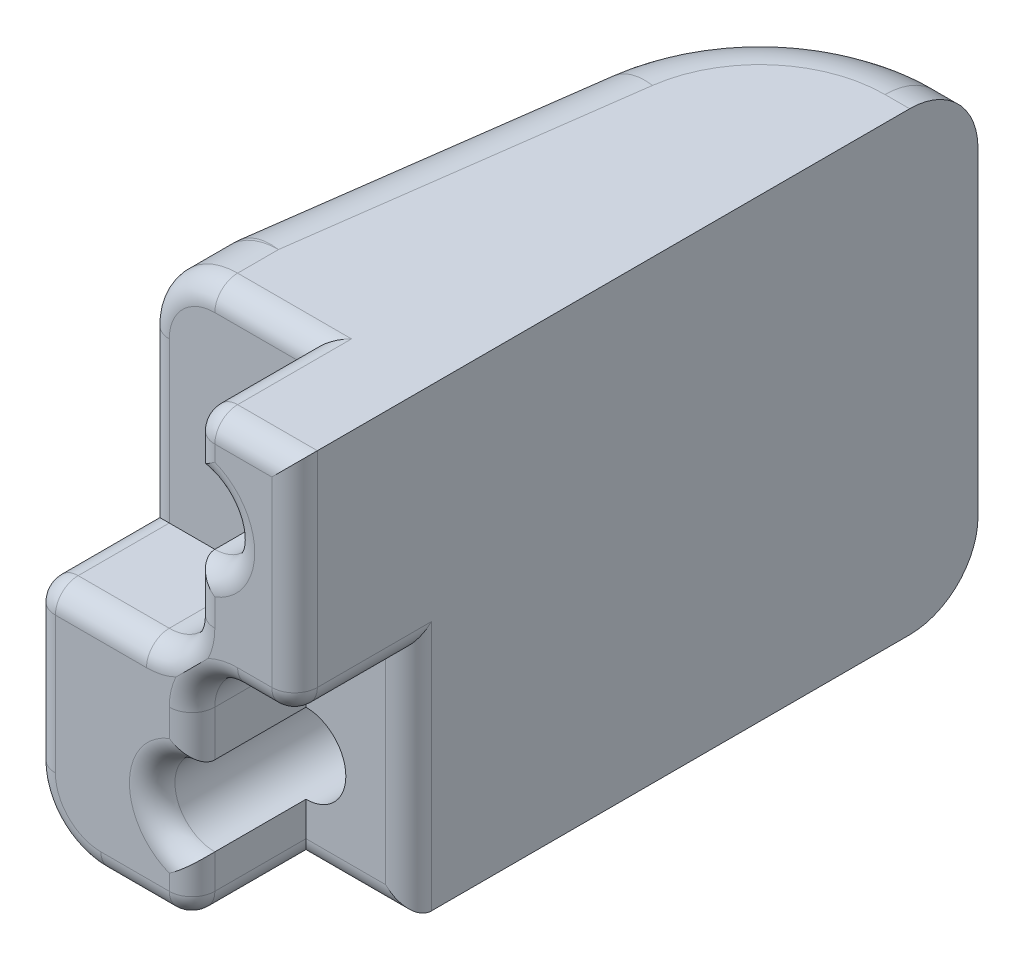
from build123d import *

# Parameters (mm, degrees)
BOSS_EXTRUDE1_DEPTH     = 10
CUT_EXTRUDE1_DEPTH      = 5
CUT_EXTRUDE2_DEPTH      = 35.583232932
CUT_EXTRUDE2_DEPTH_BACK = 35.583232932
SKETCH3_R               = 1.75
CUT_EXTRUDE3_START      = -12
SKETCH4_R               = 3.25
CUT_EXTRUDE3_DEPTH      = 23.583232932
FILLET1_R               = 8.5
FILLET2_R               = 1
FILLET3_R               = 3


with BuildPart() as part:
    # Sketch1 → Boss-Extrude1 (new, symmetric)
    with BuildSketch(Plane(origin=(0, 0, 0), x_dir=(1, 0, 0), z_dir=(0, 1, 0))):
        Polygon((14, 0), (14, 8), (11, 30), (2.5, 30), (2.5, 8), (2.5, 0), align=None)
    extrude(amount=BOSS_EXTRUDE1_DEPTH, both=True)

    # Sketch2 → Cut-Extrude1 (cut)
    with BuildSketch(Plane.XY):
        with BuildLine():
            Line((14, 10), (7, 10))
            Line((7, 10), (7, 2))
            ThreePointArc((7, 2), (7.585786438, 0.585786438), (9, 0))
            Line((9, 0), (14, 0))
            Line((14, 0), (14, 10))
        make_face()
        with BuildLine():
            Line((5, 0), (2.5, 0))
            Line((2.5, 0), (2.5, -10))
            Line((2.5, -10), (7, -10))
            Line((7, -10), (7, -2))
            ThreePointArc((7, -2), (6.414213562, -0.585786438), (5, 0))
        make_face()
    extrude(amount=-CUT_EXTRUDE1_DEPTH, mode=Mode.SUBTRACT)

    # Sketch3 → Cut-Extrude2 (cut, two sides: drawn at the far end of the back side and taken through both)
    with BuildSketch(Plane.XY.offset(-CUT_EXTRUDE2_DEPTH_BACK)):
        with Locations((7, 5.75)):
            Circle(SKETCH3_R)
        with Locations((7, -5.75)):
            Circle(SKETCH3_R)
    extrude(amount=CUT_EXTRUDE2_DEPTH + CUT_EXTRUDE2_DEPTH_BACK, mode=Mode.SUBTRACT)

    # Sketch4 → Cut-Extrude3 (cut, through all)
    with BuildSketch(Plane.XY.offset(CUT_EXTRUDE3_START)):
        with Locations((7, 5.75)):
            Circle(SKETCH4_R)
        with Locations((7, -5.75)):
            Circle(SKETCH4_R)
    extrude(amount=-CUT_EXTRUDE3_DEPTH, mode=Mode.SUBTRACT)

    # Fillet1
    # the kernel refuses this fillet: 8.5 mm, written as the material it takes off along each edge
    with BuildSketch(Plane(origin=(11, -28.548935016, -30), x_dir=(0.1351132047333134, 0, 0.9908301680442989), z_dir=(0, 1, 0))) as fillet1_piece_1:
        with BuildLine():
            CenterArc((FILLET1_R * 0.872891059599, -FILLET1_R), FILLET1_R, 90, 82.234833982)
            Line((-FILLET1_R * 0.117939108445, -FILLET1_R * 0.864886795267), (0, 0))
            Line((0, 0), (FILLET1_R * 0.872891059599, 0))
        make_face()
    extrude(amount=57.097870033, mode=Mode.SUBTRACT)

    # Fillet2
    # the kernel refuses this fillet: 1 mm, written as the material it takes off along each edge
    with BuildSketch(Plane(origin=(3.5, 1, -1), x_dir=(0, -1, 0), z_dir=(0, 0, 1))) as fillet2_piece_1_section:
        Polygon((0, 0), (FILLET2_R, 0), (FILLET2_R, -FILLET2_R), (0, -FILLET2_R), align=None)
    fillet2_piece_1 = extrude(amount=FILLET2_R, mode=Mode.PRIVATE)
    fillet2_piece_1 = fillet2_piece_1 - Plane(origin=(3.5, 1, -1), x_dir=(0.7071067811865475, 0.7071067811865476, 0), z_dir=(0, 0, 1)) * Sphere(FILLET2_R, mode=Mode.PRIVATE)
    add(fillet2_piece_1, mode=Mode.SUBTRACT)
    with BuildSketch(Plane(origin=(8, -9, -1), x_dir=(0, -1, 0), z_dir=(0, 0, 1))) as fillet2_piece_2_section:
        Polygon((0, 0), (FILLET2_R, 0), (FILLET2_R, -FILLET2_R), (0, -FILLET2_R), align=None)
    fillet2_piece_2 = extrude(amount=FILLET2_R, mode=Mode.PRIVATE)
    fillet2_piece_2 = fillet2_piece_2 - Plane(origin=(8, -9, -1), x_dir=(0.7071067811865475, 0.7071067811865475, 0), z_dir=(0, 0, 1)) * Sphere(FILLET2_R, mode=Mode.PRIVATE)
    add(fillet2_piece_2, mode=Mode.SUBTRACT)
    with BuildSketch(Plane(origin=(13, -1, -1), x_dir=(0, 0, 1), z_dir=(1, 0, 0))) as fillet2_piece_3_section:
        Polygon((0, 0), (FILLET2_R, 0), (FILLET2_R, -FILLET2_R), (0, -FILLET2_R), align=None)
    fillet2_piece_3 = extrude(amount=FILLET2_R, mode=Mode.PRIVATE)
    fillet2_piece_3 = fillet2_piece_3 - Plane(origin=(13, -1, -1), x_dir=(0, -0.7071067811865475, -0.7071067811865475), z_dir=(1, 0, 0)) * Sphere(FILLET2_R, mode=Mode.PRIVATE)
    add(fillet2_piece_3, mode=Mode.SUBTRACT)
    with BuildSketch(Plane(origin=(6, 9, -1), x_dir=(0, 1, 0), z_dir=(0, 0, 1))) as fillet2_piece_4_section:
        Polygon((0, 0), (FILLET2_R, 0), (FILLET2_R, -FILLET2_R), (0, -FILLET2_R), align=None)
    fillet2_piece_4 = extrude(amount=FILLET2_R, mode=Mode.PRIVATE)
    fillet2_piece_4 = fillet2_piece_4 - Plane(origin=(6, 9, -1), x_dir=(-0.7071067811865475, -0.7071067811865477, 0), z_dir=(0, 0, 1)) * Sphere(FILLET2_R, mode=Mode.PRIVATE)
    add(fillet2_piece_4, mode=Mode.SUBTRACT)
    with BuildSketch(Plane(origin=(2.5, 12.5, 0), x_dir=(1, 0, 0), z_dir=(0, -1, 0)), Plane(origin=(14, -1, 0), x_dir=(0, 0, -1), z_dir=(0, -1, 0))) as fillet2_piece_5:
        with BuildLine():
            CenterArc((FILLET2_R, -FILLET2_R), FILLET2_R, 90, 90)
            Line((0, -FILLET2_R), (0, 0))
            Line((0, 0), (FILLET2_R, 0))
        make_face()
    extrude(amount=11.5, mode=Mode.SUBTRACT)
    with BuildSketch(Plane(origin=(8, -10, 0), x_dir=(0, 1, 0), z_dir=(1, 0, 0))) as fillet2_piece_6:
        with BuildLine():
            CenterArc((FILLET2_R, -FILLET2_R), FILLET2_R, 90, 90)
            Line((0, -FILLET2_R), (0, 0))
            Line((0, 0), (FILLET2_R, 0))
        make_face()
    extrude(amount=8.5, mode=Mode.SUBTRACT)
    with BuildSketch(Plane(origin=(2.5, 0, -5), x_dir=(0, 0, -1), z_dir=(0, -1, 0)), Plane(origin=(14, 0, -5), x_dir=(0, 0, -1), z_dir=(0, 1, 0))) as fillet2_piece_7:
        with BuildLine():
            CenterArc((FILLET2_R, FILLET2_R), FILLET2_R, 180, 90)
            Line((0, FILLET2_R), (0, 0))
            Line((0, 0), (FILLET2_R, 0))
        make_face()
    extrude(amount=12.5, mode=Mode.SUBTRACT)
    with BuildSketch(Plane(origin=(2.5, 0, -1), x_dir=(1, 0, 0), z_dir=(0, 0, -1)), Plane(origin=(7, -10, -1), x_dir=(1, 0, 0), z_dir=(0, 0, -1)), Plane(origin=(7, 10, -1), x_dir=(-1, 0, 0), z_dir=(0, 0, -1))) as fillet2_piece_8:
        with BuildLine():
            CenterArc((FILLET2_R, -FILLET2_R), FILLET2_R, 90, 90)
            Line((0, -FILLET2_R), (0, 0))
            Line((0, 0), (FILLET2_R, 0))
        make_face()
    extrude(amount=4, mode=Mode.SUBTRACT)
    with BuildSketch(Plane(origin=(0, -10, -5), x_dir=(0, 0, -1), z_dir=(1, 0, 0))) as fillet2_piece_9:
        with BuildLine():
            CenterArc((FILLET2_R, FILLET2_R), FILLET2_R, 180, 90)
            Line((0, FILLET2_R), (0, 0))
            Line((0, 0), (FILLET2_R, 0))
        make_face()
    extrude(amount=7, mode=Mode.SUBTRACT)
    with BuildSketch(Plane(origin=(7, -9, 0), x_dir=(1, 0, 0), z_dir=(0, 1, 0)), Plane(origin=(14, 0, -1), x_dir=(0, -1, 0), z_dir=(0, 0, -1)), Plane(origin=(7, 9, 0), x_dir=(-1, 0, 0), z_dir=(0, -1, 0)), Plane(origin=(9, 0, 0), x_dir=(0, -1, 0), z_dir=(1, 0, 0))) as fillet2_piece_10:
        with BuildLine():
            CenterArc((FILLET2_R, FILLET2_R), FILLET2_R, 180, 90)
            Line((0, FILLET2_R), (0, 0))
            Line((0, 0), (FILLET2_R, 0))
        make_face()
    extrude(amount=4, mode=Mode.SUBTRACT)
    with BuildSketch(Plane(origin=(5, -2, 0), x_dir=(1, 0, 0), z_dir=(0, -1, 0))) as fillet2_piece_11:
        with BuildLine():
            CenterArc((2 + FILLET2_R, -FILLET2_R), FILLET2_R, 90, 90)
            Line((2, -FILLET2_R), (2, 0))
            Line((2, 0), (2 + FILLET2_R, 0))
        make_face()
    revolve(axis=Axis((5, -2, 0), (0, 0, 1)), revolution_arc=90, mode=Mode.SUBTRACT)
    with BuildSketch(Plane(origin=(5, 0, 0), x_dir=(0, 1, 0), z_dir=(-1, 0, 0))) as fillet2_piece_12:
        with BuildLine():
            CenterArc((FILLET2_R, FILLET2_R), FILLET2_R, 180, 90)
            Line((0, FILLET2_R), (0, 0))
            Line((0, 0), (FILLET2_R, 0))
        make_face()
    extrude(amount=1.5, mode=Mode.SUBTRACT)
    with BuildSketch(Plane(origin=(16.5, 10, -5), x_dir=(0, -1, 0), z_dir=(-1, 0, 0))) as fillet2_piece_13:
        with BuildLine():
            CenterArc((FILLET2_R, -FILLET2_R), FILLET2_R, 90, 90)
            Line((0, -FILLET2_R), (0, 0))
            Line((0, 0), (FILLET2_R, 0))
        make_face()
    extrude(amount=9.5, mode=Mode.SUBTRACT)
    with BuildSketch(Plane(origin=(9, 2, 0), x_dir=(-1, 0, 0), z_dir=(0, 1, 0))) as fillet2_piece_14:
        with BuildLine():
            CenterArc((2 + FILLET2_R, -FILLET2_R), FILLET2_R, 90, 90)
            Line((2, -FILLET2_R), (2, 0))
            Line((2, 0), (2 + FILLET2_R, 0))
        make_face()
    revolve(axis=Axis((9, 2, 0), (0, 0, 1)), revolution_arc=90, mode=Mode.SUBTRACT)
    with BuildSketch(Plane(origin=(0, 10, 0), x_dir=(0, -1, 0), z_dir=(1, 0, 0))) as fillet2_piece_15:
        with BuildLine():
            CenterArc((FILLET2_R, FILLET2_R), FILLET2_R, 180, 90)
            Line((0, FILLET2_R), (0, 0))
            Line((0, 0), (FILLET2_R, 0))
        make_face()
    extrude(amount=6, mode=Mode.SUBTRACT)
    with BuildSketch(Plane(origin=(7, 6.5, 0), x_dir=(-1, 0, 0), z_dir=(0, -1, 0)), Plane(origin=(7, -6.5, 0), x_dir=(1, 0, 0), z_dir=(0, 1, 0))) as fillet2_piece_16:
        with BuildLine():
            CenterArc((FILLET2_R, FILLET2_R), FILLET2_R, 180, 90)
            Line((0, FILLET2_R), (0, 0))
            Line((0, 0), (FILLET2_R, 0))
        make_face()
    extrude(amount=4.5, mode=Mode.SUBTRACT)
    with BuildSketch(Plane(origin=(7, 5.75, 0), x_dir=(0.9902261125437348, 0.13947130900842136, 0), z_dir=(0.13947130900842136, -0.9902261125437348, 0))) as fillet2_piece_17:
        with BuildLine():
            CenterArc((1.75 + FILLET2_R, -FILLET2_R), FILLET2_R, 90, 90)
            Line((1.75, -FILLET2_R), (1.75, 0))
            Line((1.75, 0), (1.75 + FILLET2_R, 0))
        make_face()
    revolve(axis=Axis((7, 5.75, 0), (0, 0, 1)), revolution_arc=343.965491315, mode=Mode.SUBTRACT)
    with BuildSketch(Plane(origin=(7, -5.75, 0), x_dir=(1, 0, 0), z_dir=(0, -1, 0))) as fillet2_piece_18:
        with BuildLine():
            CenterArc((1.75 + FILLET2_R, -FILLET2_R), FILLET2_R, 90, 90)
            Line((1.75, -FILLET2_R), (1.75, 0))
            Line((1.75, 0), (1.75 + FILLET2_R, 0))
        make_face()
    revolve(axis=Axis((7, -5.75, 0), (0, 0, 1)), revolution_arc=171.88399385, mode=Mode.SUBTRACT)
    with BuildSketch(Plane(origin=(7, -5.75, 0), x_dir=(-0.9899842569145015, -0.1411777994638043, 0), z_dir=(-0.1411777994638043, 0.9899842569145015, 0))) as fillet2_piece_19:
        with BuildLine():
            CenterArc((1.75 + FILLET2_R, -FILLET2_R), FILLET2_R, 90, 90)
            Line((1.75, -FILLET2_R), (1.75, 0))
            Line((1.75, 0), (1.75 + FILLET2_R, 0))
        make_face()
    revolve(axis=Axis((7, -5.75, 0), (0, 0, 1)), revolution_arc=171.88399385, mode=Mode.SUBTRACT)
    with BuildSketch(Plane(origin=(2.5, 0, -1), x_dir=(1, 0, 0), z_dir=(0, 0, -1))) as fillet2_piece_20a_section:
        with BuildLine():
            CenterArc((FILLET2_R, -FILLET2_R), FILLET2_R, 90, 90)
            Line((0, -FILLET2_R), (0, 0))
            Line((0, 0), (FILLET2_R, 0))
        make_face()
    fillet2_piece_20a = extrude(amount=6.5, mode=Mode.PRIVATE)
    fillet2_piece_20a = split(fillet2_piece_20a, bisect_by=Plane(origin=(2.726395114, 0.226395114, -5), z_dir=(0, 0, -1)), keep=Keep.TOP, mode=Mode.PRIVATE)
    with BuildSketch(Plane(origin=(2.5, 2.5, -5), x_dir=(0, 0, -1), z_dir=(0, -1, 0))) as fillet2_piece_20b_section:
        with BuildLine():
            CenterArc((FILLET2_R, FILLET2_R), FILLET2_R, 180, 90)
            Line((0, FILLET2_R), (0, 0))
            Line((0, 0), (FILLET2_R, 0))
        make_face()
    fillet2_piece_20b = extrude(amount=15, mode=Mode.PRIVATE)
    fillet2_piece_20b = split(fillet2_piece_20b, bisect_by=Plane(origin=(2.726395114, 0, -5.226395114), z_dir=(0, 1, 0)), keep=Keep.TOP, mode=Mode.PRIVATE)
    fillet2_piece_20 = fillet2_piece_20a & fillet2_piece_20b
    add(fillet2_piece_20, mode=Mode.SUBTRACT)
    with BuildSketch(Plane(origin=(7, -10, -1), x_dir=(1, 0, 0), z_dir=(0, 0, -1))) as fillet2_piece_21a_section:
        with BuildLine():
            CenterArc((FILLET2_R, -FILLET2_R), FILLET2_R, 90, 90)
            Line((0, -FILLET2_R), (0, 0))
            Line((0, 0), (FILLET2_R, 0))
        make_face()
    fillet2_piece_21a = extrude(amount=6.5, mode=Mode.PRIVATE)
    fillet2_piece_21a = split(fillet2_piece_21a, bisect_by=Plane(origin=(7.226395114, -9.773604886, -5), z_dir=(0, 0, -1)), keep=Keep.TOP, mode=Mode.PRIVATE)
    with BuildSketch(Plane(origin=(0, -10, -5), x_dir=(0, 0, -1), z_dir=(1, 0, 0))) as fillet2_piece_21b_section:
        with BuildLine():
            CenterArc((FILLET2_R, FILLET2_R), FILLET2_R, 180, 90)
            Line((0, FILLET2_R), (0, 0))
            Line((0, 0), (FILLET2_R, 0))
        make_face()
    fillet2_piece_21b = extrude(amount=9.5, mode=Mode.PRIVATE)
    fillet2_piece_21b = split(fillet2_piece_21b, bisect_by=Plane(origin=(7, -9.773604886, -5.226395114), z_dir=(1, 0, 0)), keep=Keep.TOP, mode=Mode.PRIVATE)
    fillet2_piece_21 = fillet2_piece_21a & fillet2_piece_21b
    add(fillet2_piece_21, mode=Mode.SUBTRACT)
    with BuildSketch(Plane(origin=(14, 0, -1), x_dir=(0, -1, 0), z_dir=(0, 0, -1))) as fillet2_piece_22a_section:
        with BuildLine():
            CenterArc((FILLET2_R, FILLET2_R), FILLET2_R, 180, 90)
            Line((0, FILLET2_R), (0, 0))
            Line((0, 0), (FILLET2_R, 0))
        make_face()
    fillet2_piece_22a = extrude(amount=6.5, mode=Mode.PRIVATE)
    fillet2_piece_22a = split(fillet2_piece_22a, bisect_by=Plane(origin=(13.773604886, -0.226395114, -5), z_dir=(0, 0, -1)), keep=Keep.TOP, mode=Mode.PRIVATE)
    with BuildSketch(Plane(origin=(14, -2.5, -5), x_dir=(0, 0, -1), z_dir=(0, 1, 0))) as fillet2_piece_22b_section:
        with BuildLine():
            CenterArc((FILLET2_R, FILLET2_R), FILLET2_R, 180, 90)
            Line((0, FILLET2_R), (0, 0))
            Line((0, 0), (FILLET2_R, 0))
        make_face()
    fillet2_piece_22b = extrude(amount=15, mode=Mode.PRIVATE)
    fillet2_piece_22b = split(fillet2_piece_22b, bisect_by=Plane(origin=(13.773604886, 0, -5.226395114), z_dir=(0, -1, 0)), keep=Keep.TOP, mode=Mode.PRIVATE)
    fillet2_piece_22 = fillet2_piece_22a & fillet2_piece_22b
    add(fillet2_piece_22, mode=Mode.SUBTRACT)
    with BuildSketch(Plane(origin=(16.5, 10, -5), x_dir=(0, -1, 0), z_dir=(-1, 0, 0))) as fillet2_piece_23a_section:
        with BuildLine():
            CenterArc((FILLET2_R, -FILLET2_R), FILLET2_R, 90, 90)
            Line((0, -FILLET2_R), (0, 0))
            Line((0, 0), (FILLET2_R, 0))
        make_face()
    fillet2_piece_23a = extrude(amount=12, mode=Mode.PRIVATE)
    fillet2_piece_23a = split(fillet2_piece_23a, bisect_by=Plane(origin=(7, 9.773604886, -5.226395114), z_dir=(-1, 0, 0)), keep=Keep.TOP, mode=Mode.PRIVATE)
    with BuildSketch(Plane(origin=(7, 10, -1), x_dir=(-1, 0, 0), z_dir=(0, 0, -1))) as fillet2_piece_23b_section:
        with BuildLine():
            CenterArc((FILLET2_R, -FILLET2_R), FILLET2_R, 90, 90)
            Line((0, -FILLET2_R), (0, 0))
            Line((0, 0), (FILLET2_R, 0))
        make_face()
    fillet2_piece_23b = extrude(amount=6.5, mode=Mode.PRIVATE)
    fillet2_piece_23b = split(fillet2_piece_23b, bisect_by=Plane(origin=(6.773604886, 9.773604886, -5), z_dir=(0, 0, -1)), keep=Keep.TOP, mode=Mode.PRIVATE)
    fillet2_piece_23 = fillet2_piece_23a & fillet2_piece_23b
    add(fillet2_piece_23, mode=Mode.SUBTRACT)

    # Fillet3
    # the kernel refuses this fillet: 3 mm, written as the material it takes off along each edge
    with BuildSketch(Plane(origin=(11, -7, 0), x_dir=(0, -1, 0), z_dir=(-1, 0, 0))) as fillet3_piece_1:
        with BuildLine():
            CenterArc((2, -1), 1, 0, 90)
            Line((3, -1), (3, 0))
            Line((3, 0), (2, 0))
        make_face()
    revolve(axis=Axis((11, -7, 0), (0, 0, 1)), revolution_arc=90, mode=Mode.SUBTRACT)
    with BuildSketch(Plane(origin=(11, 7, -5), x_dir=(1, 0, 0), z_dir=(0, -1, 0))) as fillet3_piece_2:
        with BuildLine():
            CenterArc((2, -1), 1, 0, 90)
            Line((3, -1), (3, 0))
            Line((3, 0), (2, 0))
        make_face()
    revolve(axis=Axis((11, 7, -5), (0, 0, 1)), revolution_arc=90, mode=Mode.SUBTRACT)
    with BuildSketch(Plane(origin=(11, 7, -7.796396689), x_dir=(0.990830168044299, 0, -0.1351132047333135), z_dir=(0, 1, 0))) as fillet3_piece_3_section:
        Polygon((0, 0), (FILLET3_R, 0), (FILLET3_R, -FILLET3_R * 0.0678677703915), (FILLET3_R * 0.990830168044, -FILLET3_R * 0.135113204733), align=None)
    fillet3_piece_3 = extrude(amount=FILLET3_R, mode=Mode.PRIVATE)
    fillet3_piece_3 = fillet3_piece_3 - Plane(origin=(11, 7, -7.796396689), x_dir=(-0.9977049082880917, 0, 0.06771200763417462), z_dir=(0, 1, 0)) * Sphere(FILLET3_R, mode=Mode.PRIVATE)
    add(fillet3_piece_3, mode=Mode.SUBTRACT)
    with BuildSketch(Plane(origin=(11, -7, -7.796396689), x_dir=(1, 0, 0), z_dir=(0, -1, 0))) as fillet3_piece_4_section:
        Polygon((0, 0), (FILLET3_R, 0), (FILLET3_R, -FILLET3_R * 0.0678677703915), (FILLET3_R * 0.990830168044, -FILLET3_R * 0.135113204733), align=None)
    fillet3_piece_4 = extrude(amount=FILLET3_R, mode=Mode.PRIVATE)
    fillet3_piece_4 = fillet3_piece_4 - Plane(origin=(11, -7, -7.796396689), x_dir=(-0.9977049082880917, 0, 0.06771200763417462), z_dir=(0, -1, 0)) * Sphere(FILLET3_R, mode=Mode.PRIVATE)
    add(fillet3_piece_4, mode=Mode.SUBTRACT)
    with BuildSketch(Plane(origin=(3.580425993, 10, -21.5), x_dir=(0, 0, -1), z_dir=(-1, 0, 0))) as fillet3_piece_5:
        with BuildLine():
            CenterArc((8.5 - FILLET3_R, FILLET3_R), FILLET3_R, 270, 90)
            Line((8.5, FILLET3_R), (8.5, 0))
            Line((8.5, 0), (8.5 - FILLET3_R, 0))
        make_face()
    revolve(axis=Axis((3.580425993, 10, -21.5), (0, -1, 0)), revolution_arc=82.234833982, mode=Mode.SUBTRACT)
    with BuildSketch(Plane(origin=(13.972490504, 10, -8.201736303), x_dir=(-0.9908301680442989, 0, 0.13511320473331348), z_dir=(-0.1351132047333135, 0, -0.990830168044299)), Plane(origin=(13.972490504, -10, -8.201736303), x_dir=(0, 1, 0), z_dir=(-0.1351132047333135, 0, -0.990830168044299))) as fillet3_piece_6:
        with BuildLine():
            CenterArc((FILLET3_R, -FILLET3_R), FILLET3_R, 90, 90)
            Line((0, -FILLET3_R), (0, 0))
            Line((0, 0), (FILLET3_R, 0))
        make_face()
    extrude(amount=14.580425993, mode=Mode.SUBTRACT)
    with BuildSketch(Plane(origin=(14, 10, -5), x_dir=(0, -1, 0), z_dir=(0, 0, -1))) as fillet3_piece_7:
        with BuildLine():
            CenterArc((FILLET3_R, FILLET3_R), FILLET3_R, 180, 90)
            Line((0, FILLET3_R), (0, 0))
            Line((0, 0), (FILLET3_R, 0))
        make_face()
    extrude(amount=2.796396689, mode=Mode.SUBTRACT)
    with BuildSketch(Plane(origin=(14, -10, 0), x_dir=(0, 1, 0), z_dir=(0, 0, -1))) as fillet3_piece_8:
        with BuildLine():
            CenterArc((FILLET3_R, -FILLET3_R), FILLET3_R, 90, 90)
            Line((0, -FILLET3_R), (0, 0))
            Line((0, 0), (FILLET3_R, 0))
        make_face()
    extrude(amount=7.796396689, mode=Mode.SUBTRACT)
    with BuildSketch(Plane(origin=(3.580425993, -10, -21.5), x_dir=(0, 0, -1), z_dir=(-1, 0, 0))) as fillet3_piece_9:
        with BuildLine():
            CenterArc((8.5 - FILLET3_R, -FILLET3_R), FILLET3_R, 0, 90)
            Line((8.5 - FILLET3_R, 0), (8.5, 0))
            Line((8.5, 0), (8.5, -FILLET3_R))
        make_face()
    revolve(axis=Axis((3.580425993, -10, -21.5), (0, -1, 0)), revolution_arc=82.234833982, mode=Mode.SUBTRACT)
    with BuildSketch(Plane(origin=(3.580425993, 10, -30), x_dir=(0, 0, 1), z_dir=(-1, 0, 0)), Plane(origin=(3.580425993, -10, -30), x_dir=(0, 1, 0), z_dir=(-1, 0, 0))) as fillet3_piece_10:
        with BuildLine():
            CenterArc((FILLET3_R, -FILLET3_R), FILLET3_R, 90, 90)
            Line((0, -FILLET3_R), (0, 0))
            Line((0, 0), (FILLET3_R, 0))
        make_face()
    extrude(amount=8.580425993, mode=Mode.SUBTRACT)
    with BuildSketch(Plane(origin=(14, -7, -8), x_dir=(0, 0, 1), z_dir=(0, 1, 0))) as fillet3_piece_11:
        with BuildLine():
            CenterArc((FILLET3_R * 0.0678677703915, -FILLET3_R), FILLET3_R, 90, 7.765166018)
            Line((-FILLET3_R * 0.0672454343418, -FILLET3_R * 0.0091698319557), (0, 0))
            Line((0, 0), (FILLET3_R * 0.0678677703915, 0))
        make_face()
    extrude(amount=14, mode=Mode.SUBTRACT)


with BuildPart() as body_2:
    # Mirror4: mirrored copy
    add(part.part.mirror(Plane(origin=(0, 0, 0), x_dir=(0, 0, 1), z_dir=(1, 0, 0))))


solid = body_2.part
